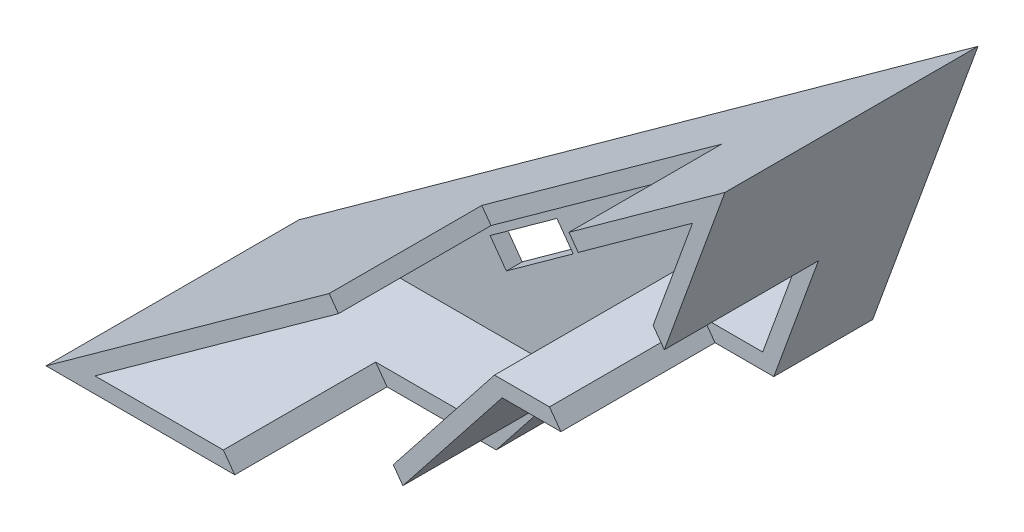
from build123d import *

# Parameters (mm, degrees)
SHELL_3_T            = 2
SKETCH_10_W          = 22.765402734
SKETCH_10_H          = 19.26138917
SKETCH_10_W_2        = 19.681614291
SKETCH_10_H_2        = 19.489043198
CUT_EXTRUDE_8_DEPTH  = 49
SKETCH_9_W           = 37.384578993
SKETCH_9_H           = 19.297136137
CUT_EXTRUDE_5_DEPTH  = 10
CUT_EXTRUDE_10_DEPTH = 49


with BuildPart() as part:
    # 草图5 → 放样2 section 0
    with BuildSketch(Plane.XY):
        with BuildLine():
            Line((123.949416554, -29.058070489), (134.559011277, 0.091551442))
            Line((134.559011277, 0.091551442), (59.000774753, -54.400934133))
            Line((59.000774753, -54.400934133), (89.51414806, -54.400934133))
            Line((89.51414806, -54.400934133), (109.519294053, -29.058070489))
            Line((109.519294053, -29.058070489), (123.949416554, -29.058070489))
        make_face()
    # 草图2 → 放样2 section 1
    with BuildSketch(Plane.XY.offset(-30)):
        with BuildLine():
            Line((134.559011277, 0.091551442), (123.949416554, -29.058070489))
            Line((123.949416554, -29.058070489), (109.519294053, -29.058070489))
            Line((109.519294053, -29.058070489), (89.51414806, -54.400934133))
            Line((89.51414806, -54.400934133), (59.000774753, -54.400934133))
            Line((59.000774753, -54.400934133), (134.559011277, 0.091551442))
        make_face()
    loft()

    # 抽壳3
    shell_3_openings = [part.faces().sort_by_distance(p)[0] for p in [
        (99.793796859, -32.953132271, 0),
    ]]
    offset(amount=SHELL_3_T, openings=shell_3_openings, kind=Kind.INTERSECTION)

    # 草图10 → 切除-拉伸8 (cut)
    with BuildSketch(Plane(origin=(45.99732156, -63.779004852, 0), x_dir=(0.8110731554347567, 0.5849447294686114, 0), z_dir=(0.5849447294686114, -0.8110731554347567, 0))):
        with Locations((40.58343187, -9.630694585)):
            Rectangle(SKETCH_10_W, SKETCH_10_H)
        with Locations((87.31465052, -9.744521599)):
            Rectangle(SKETCH_10_W_2, SKETCH_10_H_2)
    extrude(amount=CUT_EXTRUDE_8_DEPTH, mode=Mode.SUBTRACT)

    # 草图9 → 切除-拉伸5 (cut)
    with BuildSketch(Plane(origin=(44.827432101, -62.156858541, 0), x_dir=(0.8110731554347567, 0.5849447294686114, 0), z_dir=(-0.5849447294686114, 0.8110731554347567, 0))):
        with Locations((72.683721601, 9.648568069)):
            Rectangle(SKETCH_9_W, SKETCH_9_H)
    extrude(amount=-CUT_EXTRUDE_5_DEPTH, mode=Mode.SUBTRACT)

    # 草图13 → 切除-拉伸10 (cut)
    with BuildSketch(Plane.XY.offset(-30)):
        Polygon((78.963932985, -44.04826302), (81.023403307, -46.903885112), (89.476536517, -40.807498262), (87.417066196, -37.95187617), align=None)
        Polygon((103.880127445, -22.95550088), (118.225703578, -12.609493132), (121.093195937, -16.585503101), (106.747619804, -26.931510849), align=None)
    extrude(amount=-CUT_EXTRUDE_10_DEPTH, mode=Mode.SUBTRACT)


solid = part.part
